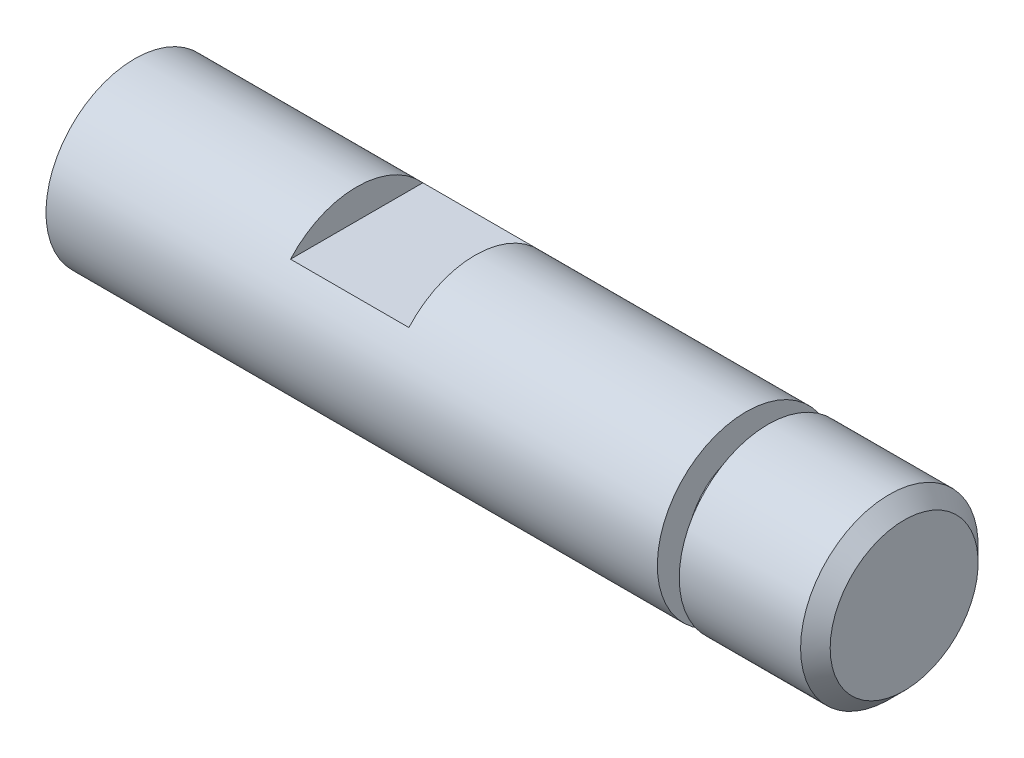
from build123d import *

# Parameters (mm, degrees)
ESQUISSE1_W                  = 52
ESQUISSE1_H                  = 3
CHANFREIN1_SIZE              = 0.5
ENL_V_MAT_EXTRU_1_DEPTH      = 27.343879745
ENL_V_MAT_EXTRU_1_DEPTH_BACK = 27.343879745
ESQUISSE2_W                  = 4
ESQUISSE2_H                  = 2
ESQUISSE3_W                  = 0.74
ESQUISSE3_H                  = 1
BOSS_EXTRU_1_START           = 15
ESQUISSE4_R                  = 3
BOSS_EXTRU_1_DEPTH           = 15
ENL_V_MAT_EXTRU_2_DEPTH      = 42.218927691
ENL_V_MAT_EXTRU_2_DEPTH_BACK = 42.218927691
ESQUISSE5_W                  = 12
ESQUISSE5_H                  = 1
ENL_V_MAT_EXTRU_3_DEPTH      = 42.218927691
ENL_V_MAT_EXTRU_3_DEPTH_BACK = 42.218927691
ESQUISSE6_W                  = 50.211323454
ESQUISSE6_H                  = 20.21753951


with BuildPart() as part:
    # Esquisse1 → Révolution1 (revolve)
    with BuildSketch(Plane.XY):
        with Locations((0, 1.5)):
            Rectangle(ESQUISSE1_W, ESQUISSE1_H)
    revolve(axis=Axis((0, 0, 0), (1, 0, 0)))

    # Chanfrein1
    chanfrein1_edges = [part.edges().sort_by_distance(p)[0] for p in [
        (26, -3, 0),
    ]]
    chamfer(chanfrein1_edges, length=CHANFREIN1_SIZE)

    # Esquisse2 → Enlèv. mat.-Extru.1 (cut, two sides: drawn at the far end of the back side and taken through both)
    with BuildSketch(Plane.XY.offset(-ENL_V_MAT_EXTRU_1_DEPTH_BACK)):
        with Locations((9.5, 3)):
            Rectangle(ESQUISSE2_W, ESQUISSE2_H)
    extrude(amount=ENL_V_MAT_EXTRU_1_DEPTH + ENL_V_MAT_EXTRU_1_DEPTH_BACK, mode=Mode.SUBTRACT)

    # Esquisse3 → Enlèvement de matière-Révolution1 (revolve, cut)
    with BuildSketch(Plane.XY):
        with Locations((-21.03, 2.5)):
            Rectangle(ESQUISSE3_W, ESQUISSE3_H)
        with Locations((21.03, 2.5)):
            Rectangle(ESQUISSE3_W, ESQUISSE3_H)
    revolve(axis=Axis((0, 0, 0), (-1, 0, 0)), mode=Mode.SUBTRACT)

    # Esquisse4 → Boss.-Extru.1 (add)
    with BuildSketch(Plane.ZY.offset(26).offset(BOSS_EXTRU_1_START)):
        Circle(ESQUISSE4_R)
    extrude(amount=-BOSS_EXTRU_1_DEPTH)

    # Esquisse5 → Enlèv. mat.-Extru.2 (cut, two sides: drawn at the far end of the back side and taken through both)
    with BuildSketch(Plane.XY.offset(-ENL_V_MAT_EXTRU_2_DEPTH_BACK)):
        with Locations((-35, 2.5)):
            Rectangle(ESQUISSE5_W, ESQUISSE5_H)
    extrude(amount=ENL_V_MAT_EXTRU_2_DEPTH + ENL_V_MAT_EXTRU_2_DEPTH_BACK, mode=Mode.SUBTRACT)

    # Esquisse6 → Enlèv. mat.-Extru.3 (cut, two sides: drawn at the far end of the back side and taken through both)
    with BuildSketch(Plane.XY.offset(-ENL_V_MAT_EXTRU_3_DEPTH_BACK)):
        with Locations((-25.105661727, 1.097333559)):
            Rectangle(ESQUISSE6_W, ESQUISSE6_H)
    extrude(amount=ENL_V_MAT_EXTRU_3_DEPTH + ENL_V_MAT_EXTRU_3_DEPTH_BACK, mode=Mode.SUBTRACT)


solid = part.part
